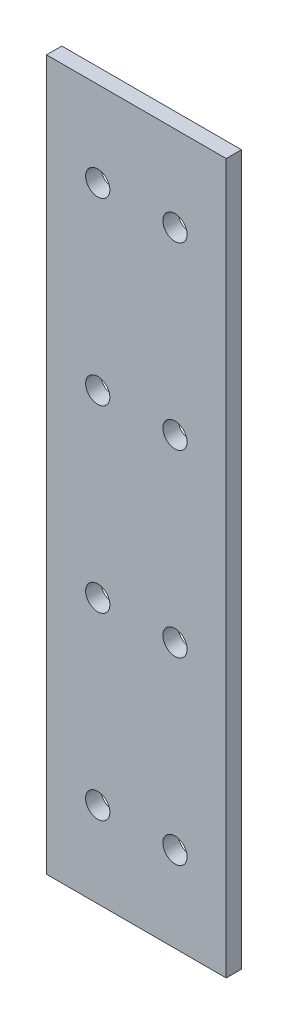
from build123d import *

# Parameters (mm, degrees)
SKETCH1_W           = 20
SKETCH1_H           = 79
BOSS_EXTRUDE1_DEPTH = 1.7
SKETCH3_R           = 1.35
CUT_EXTRUDE1_DEPTH  = 41.781613504


with BuildPart() as part:
    # Sketch1 → Boss-Extrude1 (new body)
    with BuildSketch(Plane.XY):
        Rectangle(SKETCH1_W, SKETCH1_H)
    extrude(amount=BOSS_EXTRUDE1_DEPTH)

    # Sketch3 → Cut-Extrude1 (cut, through all)
    with BuildSketch(Plane.XY.offset(1.7)):
        with Locations((-4.3, 30)):
            Circle(SKETCH3_R)
        with Locations((-4.3, 10)):
            Circle(SKETCH3_R)
        with Locations((-4.3, -10)):
            Circle(SKETCH3_R)
        with Locations((-4.3, -30)):
            Circle(SKETCH3_R)
        with Locations((4.3, -30)):
            Circle(SKETCH3_R)
        with Locations((4.3, -10)):
            Circle(SKETCH3_R)
        with Locations((4.3, 10)):
            Circle(SKETCH3_R)
        with Locations((4.3, 30)):
            Circle(SKETCH3_R)
    extrude(amount=-CUT_EXTRUDE1_DEPTH, mode=Mode.SUBTRACT)


solid = part.part
